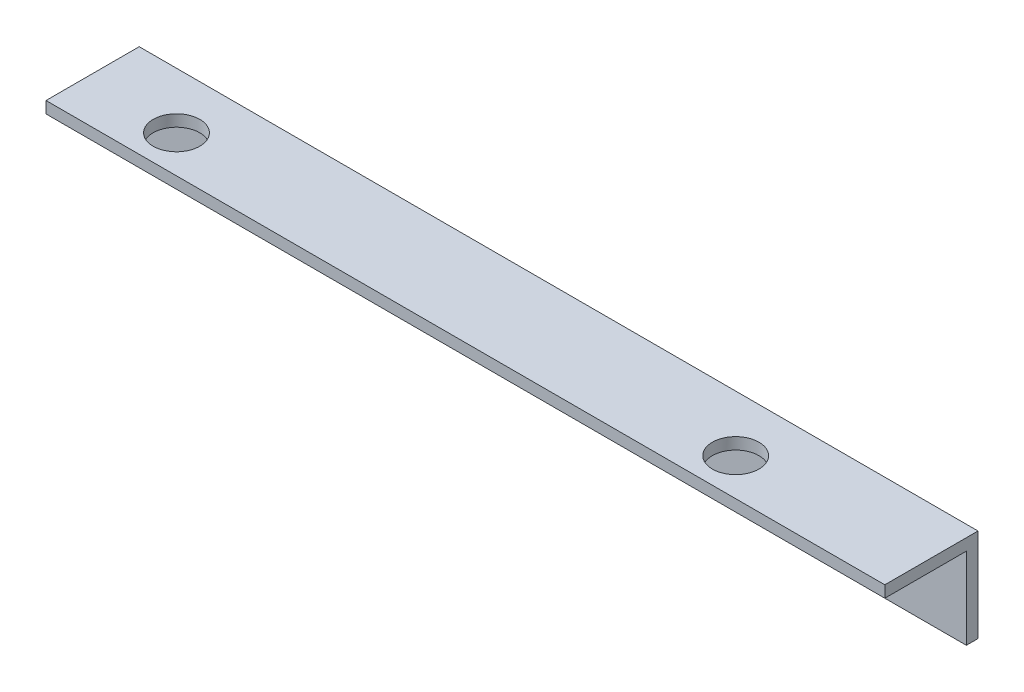
from build123d import *

# Parameters (mm, degrees)
BOSS_EXTRUDE1_DEPTH      = 57.15
BOSS_EXTRUDE1_DEPTH_BACK = 57.15
SKETCH3_R                = 3.556
CUT_EXTRUDE1_DEPTH       = 60.905780189
SKETCH4_R                = 3.175
CUT_EXTRUDE2_DEPTH       = 60.905780189


with BuildPart() as part:
    # Sketch1 → Boss-Extrude1 (new, two sides: drawn at the far end of the back side and taken through both)
    with BuildSketch(Plane(origin=(0, 0, 0), x_dir=(0, 0, -1), z_dir=(1, 0, 0)).offset(-BOSS_EXTRUDE1_DEPTH_BACK)):
        Polygon((0, 0), (0, 12.7), (-12.7, 12.7), (-12.7, 11.1125), (-1.5875, 11.1125), (-1.5875, 0), align=None)
    extrude(amount=BOSS_EXTRUDE1_DEPTH + BOSS_EXTRUDE1_DEPTH_BACK)

    # Sketch3 → Cut-Extrude1 (cut, through all)
    with BuildSketch(Plane(origin=(0, 0, 0), x_dir=(-1, 0, 0), z_dir=(0, 0, -1))):
        with Locations((31.75, 5.08)):
            Circle(SKETCH3_R)
        with Locations((-44.45, 5.08)):
            Circle(SKETCH3_R)
    extrude(amount=-CUT_EXTRUDE1_DEPTH, mode=Mode.SUBTRACT)

    # Sketch4 → Cut-Extrude2 (cut, through all)
    with BuildSketch(Plane(origin=(0, 12.7, 0), x_dir=(1, 0, 0), z_dir=(0, 1, 0))):
        with Locations((-44.45, -7.62)):
            Circle(SKETCH4_R)
        with Locations((31.75, -7.62)):
            Circle(SKETCH4_R)
    extrude(amount=-CUT_EXTRUDE2_DEPTH, mode=Mode.SUBTRACT)


solid = part.part
